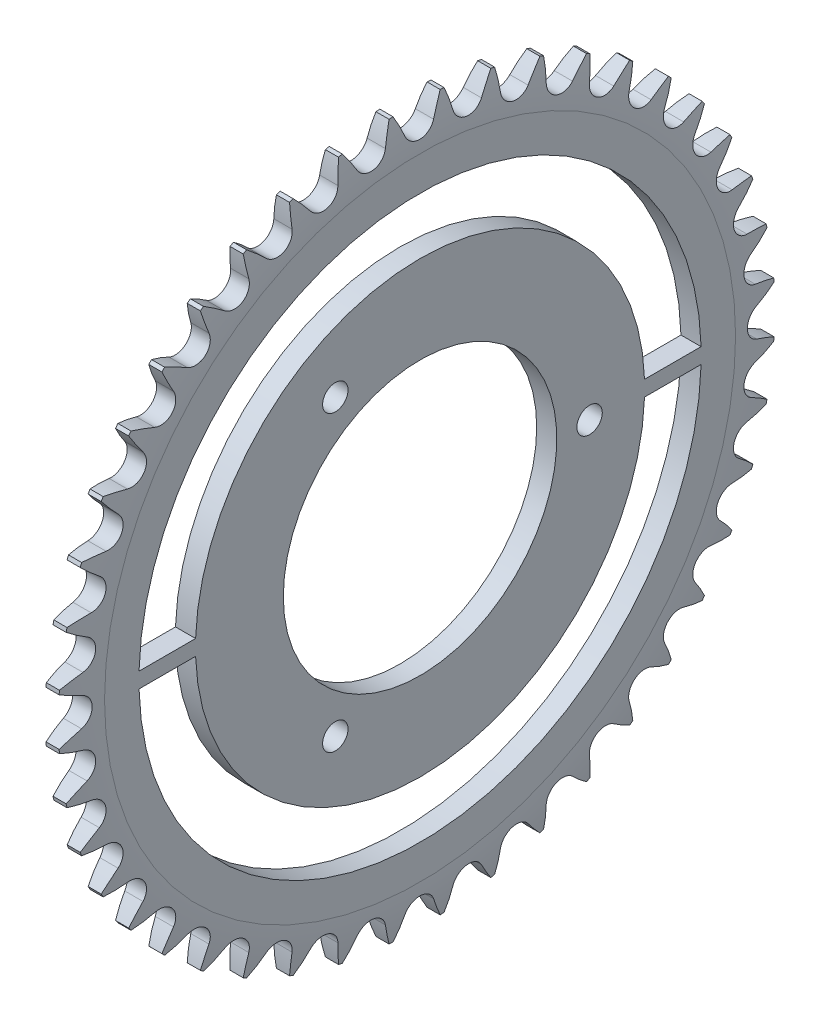
from build123d import *

# Parameters (mm, degrees)
TOOTHCUT_DEPTH      = 66.794309731
TEETHCUTS_COUNT     = 44
BORSKE_R            = 17.75
BORE_DEPTH          = 50.1095
SKETCH1_R           = 1.65
CUT_EXTRUDE1_DEPTH  = 10
SKETCH4_R           = 36.486946046
SKETCH4_R_2         = 29.15
CUT_EXTRUDE2_DEPTH  = 66.651600524
SKETCH5_W           = 7.354103754
SKETCH5_H           = 2
BOSS_EXTRUDE1_DEPTH = 2.6113
CIRPATTERN2_COUNT   = 2


with BuildPart() as part:
    # BasProSke → Base-Revolve (revolve)
    with BuildSketch(Plane(origin=(0, 0, 0), x_dir=(1, 0, 0), z_dir=(0, 1, 0)), mode=Mode.PRIVATE) as base_revolve_sk:
        with BuildLine():
            Line((0, 0), (0, 40.951144388))
            ThreePointArc((0, 40.951144388), (0.113764243, 43.728349981), (0.454294658, 46.486946046))
            Line((0.454294658, 46.486946046), (2.157005342, 46.486946046))
            ThreePointArc((2.157005342, 46.486946046), (2.497535757, 43.728349981), (2.6113, 40.951144388))
            Line((2.6113, 40.951144388), (2.6113, 0))
            Line((2.6113, 0), (0, 0))
        make_face()
    revolve(base_revolve_sk.sketch.rotate(Axis((-10, 0, 0), (1, 0, 0)), 180), axis=Axis((-10, 0, 0), (1, 0, 0)))

    # TooCutSke → ToothCut (cut, through all)
    with BuildSketch(Plane(origin=(0, 0, 0), x_dir=(0, 0, -1), z_dir=(1, 0, 0))):
        with BuildLine():
            ThreePointArc((1.873760508, 43.80544887), (2.543582408, 45.365278104), (3.331987174, 46.868656479))
            ThreePointArc((3.331987174, 46.868656479), (0, 46.986946046), (-3.331987174, 46.868656479))
            ThreePointArc((-3.331987174, 46.868656479), (-2.543582408, 45.365278104), (-1.873760508, 43.80544887))
            ThreePointArc((-1.873760508, 43.80544887), (0, 42.518196046), (1.873760508, 43.80544887))
        make_face()
    toothcut = extrude(amount=TOOTHCUT_DEPTH, mode=Mode.SUBTRACT)

    # TeethCuts: ToothCut ×44 about axis
    teethcuts_axis = Axis((-10, 0, 0), (1, 0, 0))
    for i in range(1, TEETHCUTS_COUNT):
        add(toothcut.rotate(teethcuts_axis, i * 360 / TEETHCUTS_COUNT), mode=Mode.SUBTRACT)

    # BorSke → Bore (cut, symmetric)
    with BuildSketch(Plane(origin=(0, 0, 0), x_dir=(0, 0, -1), z_dir=(1, 0, 0))):
        with Locations(Location((0, 0, 0), (0, 0, 180))):
            Circle(BORSKE_R)
    extrude(amount=BORE_DEPTH, both=True, mode=Mode.SUBTRACT)

    # Sketch1 → Cut-Extrude1 (cut)
    with BuildSketch(Plane(origin=(2.6113, 0, 0), x_dir=(0, 0, -1), z_dir=(1, 0, 0))):
        with Locations((-11, 19.052558883)):
            Circle(SKETCH1_R)
        with Locations((22, 0)):
            Circle(SKETCH1_R)
        with Locations((-11, -19.052558883)):
            Circle(SKETCH1_R)
    extrude(amount=-CUT_EXTRUDE1_DEPTH, mode=Mode.SUBTRACT)

    # Sketch4 → Cut-Extrude2 (cut, through all)
    with BuildSketch(Plane(origin=(2.6113, 0, 0), x_dir=(0, 0, -1), z_dir=(1, 0, 0))):
        Circle(SKETCH4_R)
        Circle(SKETCH4_R_2, mode=Mode.SUBTRACT)
    extrude(amount=-CUT_EXTRUDE2_DEPTH, mode=Mode.SUBTRACT)


with BuildPart() as cut_extrude2_piece_1:
    # of the separate pieces the step leaves, piece 1, a body of its own (cut_extrude2_pieces)
    add(part.part.solids().sort_by_distance((0, 0, 40.951144388))[0])



with BuildPart() as cut_extrude2_piece_2:
    # of the separate pieces the step leaves, piece 2, a body of its own (cut_extrude2_pieces)
    add(part.part.solids().sort_by_distance((0, 0, -29.15))[0])


with BuildPart() as cut_extrude2_piece_1_1:
    add(cut_extrude2_piece_1.part)

    add(cut_extrude2_piece_2.part)  # Boss-Extrude1 merges Cut-Extrude2 piece 2
    # Sketch5 → Boss-Extrude1 (add)
    with BuildSketch(Plane(origin=(2.6113, 0, 0), x_dir=(0, 0, -1), z_dir=(1, 0, 0))):
        with Locations((32.809894169, 0)):
            Rectangle(SKETCH5_W, SKETCH5_H)
    boss_extrude1 = extrude(amount=-BOSS_EXTRUDE1_DEPTH)

    # CirPattern2: Boss-Extrude1 ×2 about axis
    cirpattern2_axis = Axis((0, 0, 0), (1, 0, 0))
    for i in range(1, CIRPATTERN2_COUNT):
        add(boss_extrude1.rotate(cirpattern2_axis, i * 360 / CIRPATTERN2_COUNT))


solid = cut_extrude2_piece_1_1.part
